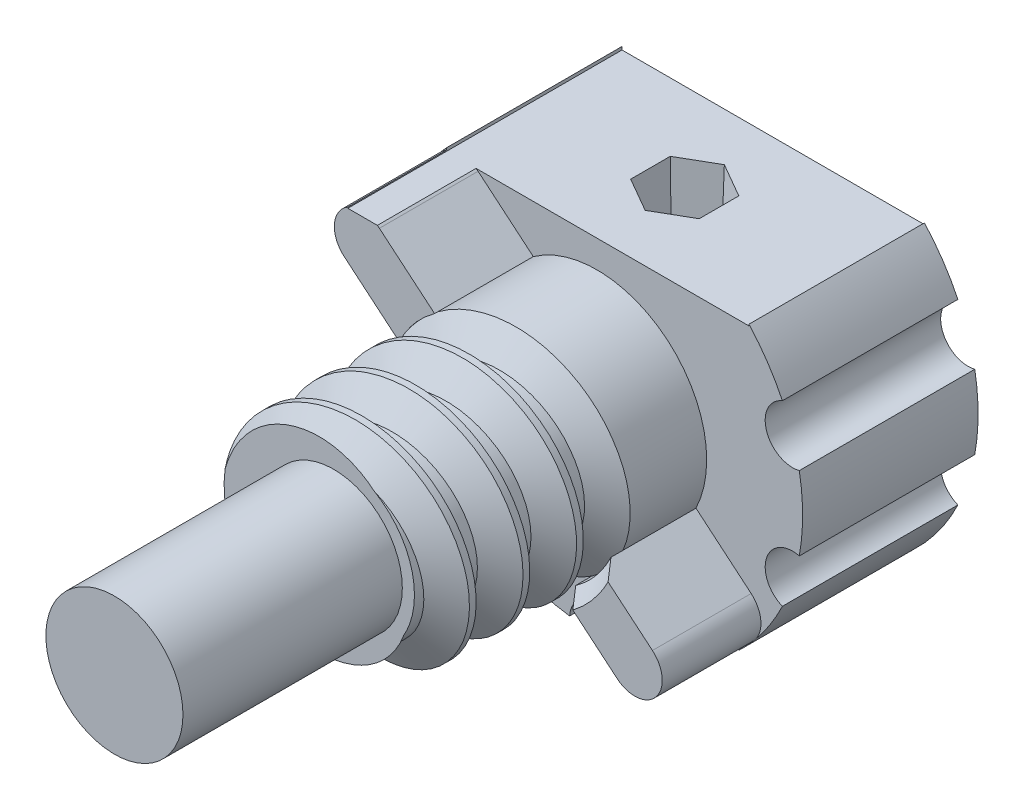
from build123d import *

# Parameters (mm, degrees)
SKETCH1_R           = 7.5
BOSS_EXTRUDE1_DEPTH = 7
SKETCH2_R           = 4
BOSS_EXTRUDE2_DEPTH = 9
BOSS_EXTRUDE3_DEPTH = 3
THREAD1_PITCH       = 1.953846154
CUT_EXTRUDE1_START  = -0.6
CUT_EXTRUDE1_DEPTH  = 0.6
SKETCH6_R           = 1
CUT_EXTRUDE2_DEPTH  = 6.4
CUT_EXTRUDE5_DEPTH  = 2.5
CIRPATTERN1_COUNT   = 10
SKETCH8_W           = 11.028385741
SKETCH8_H           = 13.864986256
CUT_EXTRUDE3_DEPTH  = 22.606429158
CUT_EXTRUDE4_DEPTH  = 4.06
CUT_EXTRUDE4_DRAFT  = -2
SKETCH10_R          = 2.5
BOSS_EXTRUDE6_DEPTH = 8
CHAMFER1_SIZE2      = 1.35099963
CHAMFER1_SIZE       = 0.78
CHAMFER2_SIZE       = 0.5


with BuildPart() as part:
    # Sketch1 → Boss-Extrude1 (new body)
    with BuildSketch(Plane.XY):
        Circle(SKETCH1_R)
        with BuildLine():
            Line((-1.535057002, 0.94), (1.535057002, 0.94))
            ThreePointArc((1.535057002, 0.94), (0, -1.8), (-1.535057002, 0.94))
        make_face(mode=Mode.SUBTRACT)
    extrude(amount=BOSS_EXTRUDE1_DEPTH)

    # Sketch2 → Boss-Extrude2 (add)
    with BuildSketch(Plane.XY.offset(7)):
        Circle(SKETCH2_R)
    extrude(amount=BOSS_EXTRUDE2_DEPTH)

    # Sketch3 → Boss-Extrude3 (add)
    with BuildSketch(Plane.XY.offset(7)):
        with BuildLine():
            Line((5.62207649, -3.41207502), (-4.336501271, 4.944163906))
            ThreePointArc((-4.336501271, 4.944163906), (-5.745333323, 4.820907073), (-5.62207649, 3.41207502))
            Line((-5.62207649, 3.41207502), (4.336501271, -4.944163906))
            ThreePointArc((4.336501271, -4.944163906), (5.745333323, -4.820907073), (5.62207649, -3.41207502))
        make_face()
    extrude(amount=BOSS_EXTRUDE3_DEPTH)

    # Thread1: the profile of Thread Profile1 profile screwed along a right-hand helix of 4.094488 turns, 10 arcs to a turn; built about Z, then put on its axis
    thread1_z = Axis((0, 0, 0), (0, 0, 1))
    thread1_corners = [(4.0003, 0, -0.000173205), (4.0003, 0, 1.709788584), (2.942449752, 0, 1.099038459), (2.942449752, 0, 0.61057692)]
    with BuildLine(mode=Mode.PRIVATE) as thread1_profile:
        Line(thread1_corners[0], thread1_corners[1])
        Line(thread1_corners[1], thread1_corners[2])
        Line(thread1_corners[2], thread1_corners[3])
        Line(thread1_corners[3], thread1_corners[0])
    thread1_cap = Face(thread1_profile.wire())
    thread1_turn_angles = [0, 18, 36, 54, 72, 90, 108, 126, 144, 162, 180, 198, 216, 234, 252, 270, 288, 306, 324, 342, 360]
    thread1_turn_weights = [1, 0.9510565162951535, 1, 0.9510565162951535, 1, 0.9510565162951535, 1, 0.9510565162951535, 1, 0.9510565162951535, 1, 0.9510565162951535, 1, 0.9510565162951535, 1, 0.9510565162951535, 1, 0.9510565162951535, 1, 0.9510565162951535, 1]
    thread1_turn_rails = [Edge.make_bspline([Vector(p[0], p[1], 0).rotate(thread1_z, thread1_turn_angles[k]) / thread1_turn_weights[k] + Vector(0, 0, p[2] + THREAD1_PITCH * thread1_turn_angles[k] / 360) for k in range(21)], [0, 0, 0, 1, 1, 2, 2, 3, 3, 4, 4, 5, 5, 6, 6, 7, 7, 8, 8, 9, 9, 10, 10, 10], 2, thread1_turn_weights) for p in thread1_corners]
    thread1_turn_sides = [Face.make_surface_from_curves(thread1_turn_rails[p[0]], thread1_turn_rails[p[1]]) for p in [(0, 1), (1, 2), (2, 3), (3, 0)]]
    thread1_last_angles = [1440, 1457.007874016, 1474.015748031]
    thread1_last_weights = [1, 0.9562645670201281, 1]
    thread1_last_rails = [Edge.make_bspline([Vector(p[0], p[1], 0).rotate(thread1_z, thread1_last_angles[k]) / thread1_last_weights[k] + Vector(0, 0, p[2] + THREAD1_PITCH * thread1_last_angles[k] / 360) for k in range(3)], [0, 0, 0, 1, 1, 1], 2, thread1_last_weights) for p in thread1_corners]
    thread1_last_sides = [Face.make_surface_from_curves(thread1_last_rails[p[0]], thread1_last_rails[p[1]]) for p in [(0, 1), (1, 2), (2, 3), (3, 0)]]
    thread1 = Plane(origin=(0, 0, 17.75), x_dir=(-1, 0, 0), z_dir=(0, 0, -1)) * Solid(Shell([*[p.moved(Location((0, 0, THREAD1_PITCH * i))) for i in range(4) for p in thread1_turn_sides], *thread1_last_sides, thread1_cap, thread1_cap.rotate(thread1_z, 1474.015748031).moved(Location((0, 0, THREAD1_PITCH * 1474.015748031 / 360)))]))
    add(thread1, mode=Mode.SUBTRACT)

    # Sketch5 → Cut-Extrude1 (cut)
    with BuildSketch(Plane.XY.offset(7).offset(CUT_EXTRUDE1_START)):
        with BuildLine():
            ThreePointArc((3.60966498, -1.723461264), (2.571150439, 3.064177772), (-2.324089761, 3.255550151))
            Line((-2.324089761, 3.255550151), (-4.336501271, 4.944163906))
            ThreePointArc((-4.336501271, 4.944163906), (-5.066444623, 5.174314161), (-5.745333323, 4.820907073))
            ThreePointArc((-5.745333323, 4.820907073), (4.820907073, 5.745333323), (5.745333323, -4.820907073))
            ThreePointArc((5.745333323, -4.820907073), (5.975483578, -4.09096372), (5.62207649, -3.41207502))
            Line((5.62207649, -3.41207502), (3.60966498, -1.723461264))
        make_face()
        with BuildLine():
            ThreePointArc((4.336501271, -4.944163906), (5.066444623, -5.174314161), (5.745333323, -4.820907073))
            ThreePointArc((5.745333323, -4.820907073), (-4.820907073, -5.745333323), (-5.745333323, 4.820907073))
            ThreePointArc((-5.745333323, 4.820907073), (-5.975483578, 4.09096372), (-5.62207649, 3.41207502))
            Line((-5.62207649, 3.41207502), (-3.60966498, 1.723461264))
            ThreePointArc((-3.60966498, 1.723461264), (-2.571150439, -3.064177772), (2.324089761, -3.255550151))
            Line((2.324089761, -3.255550151), (4.336501271, -4.944163906))
        make_face()
    extrude(amount=CUT_EXTRUDE1_DEPTH, mode=Mode.SUBTRACT)

    # Sketch6 → Cut-Extrude2 (cut)
    with BuildSketch(Plane(origin=(0, 0, 0), x_dir=(-1, 0, 0), z_dir=(0, 0, -1))):
        with Locations((0, 7.5)):
            Circle(SKETCH6_R)
    cut_extrude2 = extrude(amount=-CUT_EXTRUDE2_DEPTH, mode=Mode.SUBTRACT)

    # Sketch11 → Cut-Extrude5 (cut)
    with BuildSketch(Plane(origin=(0, 0, 7), x_dir=(-1, 0, 0), z_dir=(0, 0, -1))):
        with BuildLine():
            Line((1.535057002, 0.94), (-1.535057002, 0.94))
            ThreePointArc((-1.535057002, 0.94), (0, -1.8), (1.535057002, 0.94))
        make_face()
    extrude(amount=-CUT_EXTRUDE5_DEPTH, mode=Mode.SUBTRACT)

    # CirPattern1: Cut-Extrude2 ×10 about axis
    cirpattern1_axis = Axis((0, 0, 0), (0, 0, 1))
    for i in range(1, CIRPATTERN1_COUNT):
        add(cut_extrude2.rotate(cirpattern1_axis, i * 360 / CIRPATTERN1_COUNT), mode=Mode.SUBTRACT)

    # Sketch8 → Cut-Extrude3 (cut, through all)
    with BuildSketch(Plane(origin=(0, 5, 0), x_dir=(1, 0, 0), z_dir=(0, 1, 0))):
        with Locations((0.027369313, -6.932493128)):
            Rectangle(SKETCH8_W, SKETCH8_H)
    extrude(amount=CUT_EXTRUDE3_DEPTH, mode=Mode.SUBTRACT)


with BuildPart() as cut_extrude4_tool:
    # Sketch9 → Cut-Extrude4 (with draft: the straight prism first)
    with BuildSketch(Plane(origin=(0, 5, 0), x_dir=(1, 0, 0), z_dir=(0, 1, 0))):
        Polygon((0, -1.756624327), (-1.25, -2.478312164), (-1.25, -3.921687836), (0, -4.643375673), (1.25, -3.921687836), (1.25, -2.478312164), align=None)
    extrude(amount=-CUT_EXTRUDE4_DEPTH)
    # Cut-Extrude4: the draft: its side faces are tilted about the plane it starts from
    cut_extrude4_sides = [cut_extrude4_tool.faces().sort_by_distance(p)[0] for p in [
        (-0.625, 2.97, 2.117468245),
        (-1.25, 2.97, 3.2),
        (-0.625, 2.97, 4.282531755),
        (0.625, 2.97, 4.282531755),
        (1.25, 2.97, 3.2),
        (0.625, 2.97, 2.117468245),
    ]]
    draft(cut_extrude4_sides, Plane(origin=(0, 5, 0), x_dir=(1, 0, 0), z_dir=(0, 1, 0)), CUT_EXTRUDE4_DRAFT)


with BuildPart() as part_1:
    add(part.part)

    # Cut-Extrude4: cut by cut_extrude4_tool
    add(cut_extrude4_tool.part, mode=Mode.SUBTRACT)

    # Sketch10 → Boss-Extrude6 (add)
    with BuildSketch(Plane.XY.offset(16)):
        Circle(SKETCH10_R)
    extrude(amount=BOSS_EXTRUDE6_DEPTH)

    # Chamfer1
    chamfer1_edges = [part_1.edges().sort_by_distance(p)[0] for p in [
        (0, 0.94, 9.5),
    ]]
    chamfer1_side = [part_1.faces().sort_by_distance(p)[0] for p in [
        (0, 0.94, 9.4844),
    ]]
    chamfer(chamfer1_edges, length=CHAMFER1_SIZE, length2=CHAMFER1_SIZE2, reference=chamfer1_side[0])
    chamfer1_2_edges = [part_1.edges().sort_by_distance(p)[0] for p in [
        (0, -1.8, 9.5),
    ]]
    chamfer1_2_side = [part_1.faces().sort_by_distance(p)[0] for p in [
        (0, -1.8, 9.4844),
    ]]
    chamfer(chamfer1_2_edges, length=CHAMFER1_SIZE, length2=CHAMFER1_SIZE2, reference=chamfer1_2_side[0])

    # Chamfer2
    chamfer2_edges = [part_1.edges().sort_by_distance(p)[0] for p in [
        (3.064407586, -2.571343275, 10),
    ]]
    chamfer(chamfer2_edges, length=CHAMFER2_SIZE)


solid = part_1.part
